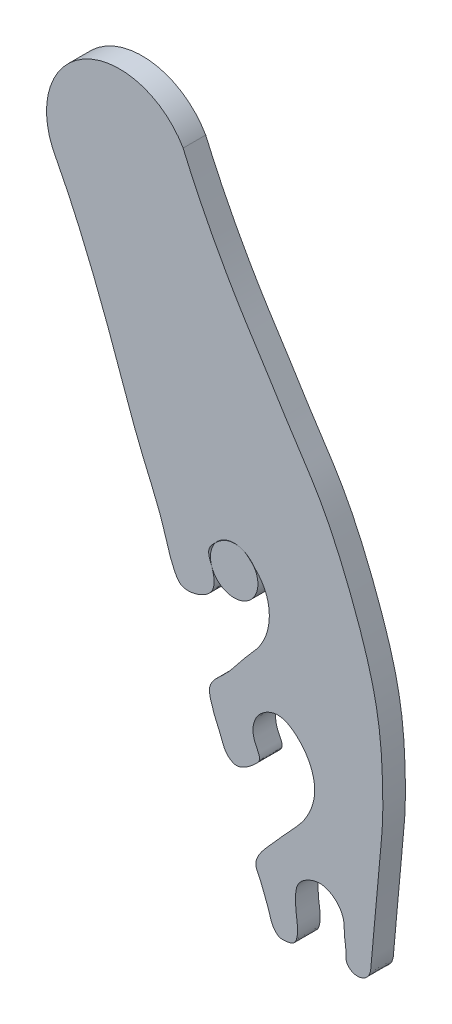
from build123d import *

# Parameters (mm, degrees)
BOSS_EXTRUDE1_DEPTH = 5
BOSS_EXTRUDE2_DEPTH = 5


with BuildPart() as part:
    # Sketch1 → Boss-Extrude1 (new body)
    with BuildSketch(Plane.XY):
        with BuildLine():
            ThreePointArc((-30.985007938, 91.196598098), (-53.054909921, 97.228421688), (-59.086733511, 75.158519704))
            add(Edge.make_bspline(
                [(-59.086733511, 75.158519704), (-53.934620409, 65.378862846), (-47.439055451, 48.683708271), (-40.688736558, 28.900997928), (-35.530418372, 18.087965765), (-33.857957781, 10.767434307), (-31.3998363, 6.578021067), (-27.521949237, 7.015818016), (-23.939322958, 9.276717273), (-24.076411695, 13.535807514), (-26.022354803, 16.823219465), (-24.443895554, 18.542484515), (-23.821825049, 19.135891662), (-23.784361274, 19.171290272)],
                knots=[0, 0, 0, 0, 0.087339457, 0.122518206, 0.154526003, 0.173634338, 0.178356301, 0.18775234, 0.197551248, 0.206693528, 0.216055213, 0.221691693, 0.222052473, 0.222052473, 0.222052473, 0.222052473], degree=3))
            ThreePointArc((-23.784361274, 19.171290272), (-21.353313982, 20.868287258), (-18.39061408, 20.978736329))
            add(Edge.make_bspline(
                [(-18.39061408, 20.978736329), (-18.130086369, 20.917885362), (-17.877883774, 20.834146371), (-17.639269045, 20.726128953)],
                knots=[0.236246142, 0.236246142, 0.236246142, 0.236246142, 0.238158412, 0.238158412, 0.238158412, 0.238158412], degree=3))
            ThreePointArc((-17.639269045, 20.726128953), (-16.378197146, 19.969719627), (-15.376197871, 18.89340422))
            add(Edge.make_bspline(
                [(-15.376197871, 18.89340422), (-15.082221931, 18.609658247), (-14.082413013, 17.624532827), (-12.329710699, 15.032055724), (-11.450768513, 10.083116207), (-13.301306093, 4.553215231), (-17.802222663, 0.020169412), (-20.92362336, -4.708488512), (-25.684891915, -8.247291068), (-24.7171376, -12.313090845), (-23.710756791, -14.977413167), (-22.475643776, -17.519411113), (-21.766182041, -19.961688271), (-19.567714742, -21.634761452), (-17.054705023, -20.623403245), (-15.514830328, -19.356466702), (-13.602241321, -17.544176686), (-14.960313044, -15.260538239), (-15.773587706, -12.816920275), (-15.094805219, -9.858138299), (-12.932936902, -7.643713981), (-9.341660228, -6.434588786), (-5.491374991, -8.897572671), (-2.613019676, -12.652358716), (-1.563890844, -16.977072215), (-2.368091716, -20.95308758), (-4.255805257, -24.700983393), (-7.942373056, -28.466412654), (-11.236370467, -32.256388462), (-13.97605086, -35.229697097), (-15.306334243, -38.005688937), (-13.922413953, -40.292452866), (-13.161399044, -42.61761536), (-11.989725545, -45.22083061), (-11.508081611, -47.730022002), (-9.864601865, -49.672146273), (-8.054793358, -49.436023324), (-6.192324987, -49.160777502), (-5.396208815, -46.329305908), (-5.958832199, -43.550924044), (-6.168512168, -40.274765919), (-5.991072136, -36.944497525), (-3.318522169, -35.101206067), (-0.290133932, -34.236756277), (2.915844901, -35.719496977), (4.831465659, -38.793949272), (4.570599211, -42.07794731), (5.229943091, -44.584125896), (4.922437711, -46.926989326), (6.593253274, -48.31337356), (8.632859256, -48.284437582), (10.396641074, -46.921479009), (10.617319534, -44.949548528), (10.867436211, -41.346590576), (11.363324993, -36.223279467), (12.019433, -29.487187687), (12.533565674, -23.28027968), (13.266936139, -16.321026149), (13.246838304, -8.525784247), (12.769980947, 0.115298958), (11.290030545, 8.713153258), (8.579641588, 17.714711088), (4.659189351, 28.101051635), (-0.377397826, 39.121903113), (-6.824107734, 48.352954408), (-11.933718441, 56.801855673), (-20.741334725, 70.168260911), (-26.966879034, 81.852505207), (-30.985007938, 91.196598098)],
                knots=[0.245267232, 0.245267232, 0.245267232, 0.245267232, 0.248249109, 0.255571387, 0.267719317, 0.28361647, 0.296048224, 0.313658019, 0.326739548, 0.33325037, 0.341962213, 0.348063706, 0.353713631, 0.360676314, 0.364714938, 0.37220146, 0.37618883, 0.381724752, 0.388580265, 0.395502954, 0.402401832, 0.410616688, 0.420878684, 0.432954596, 0.445134807, 0.451805618, 0.462304252, 0.475264192, 0.490195112, 0.498691187, 0.505626305, 0.510038062, 0.517164296, 0.523794983, 0.530641204, 0.536109008, 0.539904406, 0.543418663, 0.54895649, 0.558110844, 0.564731092, 0.573167652, 0.580565977, 0.586634968, 0.595642441, 0.604032026, 0.61150344, 0.619001254, 0.623087475, 0.627664112, 0.632724642, 0.637027563, 0.642687153, 0.646352778, 0.663711928, 0.680091232, 0.695897734, 0.709224188, 0.731217372, 0.752778928, 0.772428431, 0.79482198, 0.821372889, 0.853601156, 0.88301925, 0.903483119, 0.925781116, 1, 1, 1, 1], degree=3))
        make_face()
    extrude(amount=BOSS_EXTRUDE1_DEPTH)


with BuildPart() as body_2:
    # Sketch1<3> → Boss-Extrude2 (new body)
    with BuildSketch(Plane.XY):
        with BuildLine():
            ThreePointArc((-14.431116363, 15.887403482), (-14.672953468, 17.462936685), (-15.376197871, 18.89340422))
            add(Edge.make_bspline(
                [(-17.639269045, 20.726128953), (-17.570726219, 20.695100612), (-16.860965496, 20.347369864), (-16.158173354, 19.642474893), (-15.506942095, 19.019598721), (-15.376197871, 18.89340422)],
                knots=[0.238158412, 0.238158412, 0.238158412, 0.238158412, 0.238707718, 0.243941058, 0.245267232, 0.245267232, 0.245267232, 0.245267232], degree=3))
            ThreePointArc((-17.639269045, 20.726128953), (-18.010170079, 20.866624745), (-18.39061408, 20.978736329))
            add(Edge.make_bspline(
                [(-23.784361274, 19.171290272), (-23.083260011, 19.833743811), (-21.578736599, 21.006070895), (-19.404512048, 21.215550567), (-18.39061408, 20.978736329)],
                knots=[0.222052473, 0.222052473, 0.222052473, 0.222052473, 0.228804145, 0.236246142, 0.236246142, 0.236246142, 0.236246142], degree=3))
            ThreePointArc((-23.784361274, 19.171290272), (-21.424421713, 10.930915239), (-14.431116363, 15.887403482))
        make_face()
    extrude(amount=BOSS_EXTRUDE2_DEPTH)


solid = Compound([part.part, body_2.part])
